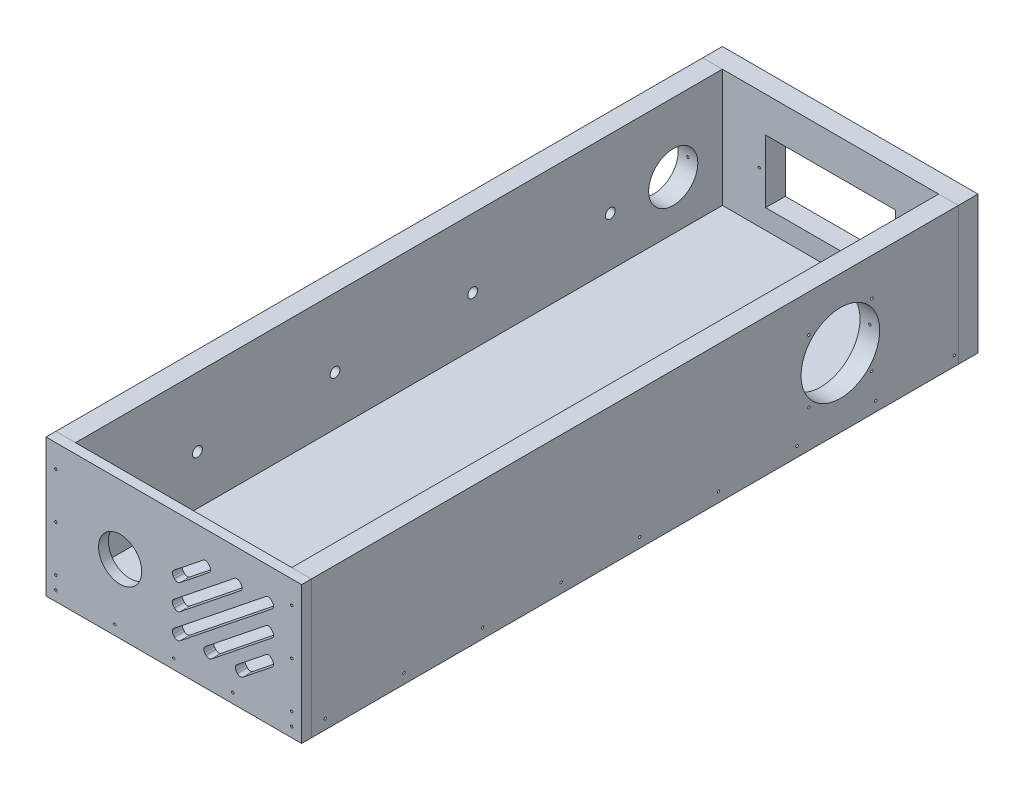
from build123d import *

# Parameters (mm, degrees)
SKETCH1_W                                = 130
SKETCH1_H                                = 344
BOSS_EXTRUDE1_DEPTH                      = 10
SKETCH2_W                                = 130
SKETCH2_H                                = 344
SKETCH2_W_2                              = 110
SKETCH2_H_2                              = 329
BOSS_EXTRUDE2_DEPTH                      = 60
CUT_EXTRUDE_THIN1_REACH                  = 359.017
CUT_EXTRUDE1_REACH                       = 359.017
SKETCH4_R                                = 11
FILLET1_R                                = 2
SKETCH5_R                                = 20
SKETCH5_W                                = 66
SKETCH5_H                                = 32
CUT_EXTRUDE4_DEPTH                       = 10
SKETCH7_R                                = 20
CUT_EXTRUDE5_DEPTH                       = 15
F_1_2_1_2_DIAMETER_HOLE1_D               = 1.2
F_1_2_1_2_DIAMETER_HOLE1_DEPTH           = 10
F_1_2_1_2_DIAMETER_HOLE1_ON_FACE_2_D     = 1.2
F_1_2_1_2_DIAMETER_HOLE1_ON_FACE_2_DEPTH = 10
F_1_2_1_2_DIAMETER_HOLE1_ON_FACE_3_D     = 1.2
F_1_2_1_2_DIAMETER_HOLE1_ON_FACE_3_DEPTH = 10
SKETCH9_R                                = 2.5
CUT_EXTRUDE6_DEPTH                       = 194.414063604
LPATTERN1_COUNT                          = 3
LPATTERN1_PITCH                          = 50
LPATTERN1_COL_COUNT                      = 3
LPATTERN1_COL_PITCH                      = 50
F_1_2_1_2_DIAMETER_HOLE2_D               = 1.2
F_1_2_1_2_DIAMETER_HOLE3_D               = 1.2
LPATTERN2_COUNT                          = 5
LPATTERN2_PITCH                          = 40
LPATTERN2_COL_COUNT                      = 5
LPATTERN2_COL_PITCH                      = 40
F_5_0_5_DIAMETER_HOLE1_D                 = 5
F_5_0_5_DIAMETER_HOLE1_DEPTH             = 10
F_25_0_25_DIAMETER_HOLE1_D               = 25
F_25_0_25_DIAMETER_HOLE1_DEPTH           = 10
SPLIT1_START                             = -172
SPLIT1_OUTLINE_W                         = 130
SPLIT1_OUTLINE_H                         = 70
SPLIT1_OUTLINE_R                         = 0.6
SPLIT1_OUTLINE_W_2                       = 66
SPLIT1_OUTLINE_H_2                       = 32
SPLIT1_DEPTH                             = 10
SPLIT1_START_2                           = 167
SPLIT1_2_OUTLINE_W                       = 130
SPLIT1_2_OUTLINE_H                       = 70
SPLIT1_2_OUTLINE_R                       = 0.6
SPLIT1_2_OUTLINE_R_2                     = 11
SPLIT1_2_DEPTH                           = 5
SPLIT1_3_OUTLINE_W                       = 130
SPLIT1_3_OUTLINE_H                       = 70
SPLIT1_3_OUTLINE_W_2                     = 66
SPLIT1_3_OUTLINE_H_2                     = 32
SPLIT1_3_OUTLINE_R                       = 0.6
SPLIT1_3_DEPTH                           = 10
SPLIT1_4_OUTLINE_W                       = 130
SPLIT1_4_OUTLINE_H                       = 70
SPLIT1_4_OUTLINE_R                       = 0.6
SPLIT1_4_OUTLINE_R_2                     = 11
SPLIT1_4_DEPTH                           = 5
SPLIT2_START                             = -65
SPLIT2_OUTLINE_W                         = 70
SPLIT2_OUTLINE_H                         = 329
SPLIT2_OUTLINE_R                         = 0.6
SPLIT2_OUTLINE_R_2                       = 12.5
SPLIT2_OUTLINE_R_3                       = 2.5
SPLIT2_DEPTH                             = 4.3999999
SPLIT2_START_2                           = -59.3999999
SPLIT2_2_OUTLINE_W                       = 70
SPLIT2_2_OUTLINE_H                       = 329
SPLIT2_2_OUTLINE_R                       = 0.6
SPLIT2_2_OUTLINE_R_2                     = 12.5
SPLIT2_2_OUTLINE_R_3                     = 2.5
SPLIT2_2_DEPTH                           = 4.3999999
SPLIT2_START_3                           = -60.6000001
SPLIT2_3_OUTLINE_W                       = 70
SPLIT2_3_OUTLINE_H                       = 329
SPLIT2_3_OUTLINE_R                       = 0.6
SPLIT2_3_OUTLINE_R_2                     = 12.5
SPLIT2_3_OUTLINE_R_3                     = 2.5
SPLIT2_3_DEPTH                           = 1.2000002
SPLIT2_START_4                           = -162
SPLIT2_4_OUTLINE_R                       = 0.6
SPLIT2_4_DEPTH                           = 329
SPLIT2_5_OUTLINE_W                       = 70
SPLIT2_5_OUTLINE_H                       = 329
SPLIT2_5_OUTLINE_R                       = 0.6
SPLIT2_5_OUTLINE_R_2                     = 12.5
SPLIT2_5_OUTLINE_R_3                     = 2.5
SPLIT2_5_DEPTH                           = 10
SPLIT2_START_5                           = 55
SPLIT2_6_OUTLINE_W                       = 70
SPLIT2_6_OUTLINE_H                       = 329
SPLIT2_6_OUTLINE_R                       = 0.6
SPLIT2_6_OUTLINE_R_2                     = 20
SPLIT2_6_DEPTH                           = 10
SPLIT2_7_OUTLINE_W                       = 70
SPLIT2_7_OUTLINE_H                       = 329
SPLIT2_7_OUTLINE_R                       = 0.6
SPLIT2_7_OUTLINE_R_2                     = 20
SPLIT2_7_DEPTH                           = 4.399999899
SPLIT2_START_6                           = 60.6000001
SPLIT2_8_OUTLINE_W                       = 70
SPLIT2_8_OUTLINE_H                       = 329
SPLIT2_8_OUTLINE_R                       = 0.6
SPLIT2_8_OUTLINE_R_2                     = 20
SPLIT2_8_DEPTH                           = 4.3999999
SPLIT2_START_7                           = 59.399999899
SPLIT2_9_OUTLINE_W                       = 70
SPLIT2_9_OUTLINE_H                       = 329
SPLIT2_9_OUTLINE_R                       = 0.6
SPLIT2_9_OUTLINE_R_2                     = 20
SPLIT2_9_DEPTH                           = 1.200000201
SPLIT2_10_OUTLINE_R                      = 0.6
SPLIT2_10_DEPTH                          = 329


with BuildPart() as part:
    # Sketch1 → Boss-Extrude1 (new body)
    with BuildSketch(Plane(origin=(0, 0, 0), x_dir=(1, 0, 0), z_dir=(0, 1, 0))):
        Rectangle(SKETCH1_W, SKETCH1_H)
    extrude(amount=BOSS_EXTRUDE1_DEPTH)

    # Sketch2 → Boss-Extrude2 (add)
    with BuildSketch(Plane(origin=(0, 10, 0), x_dir=(1, 0, 0), z_dir=(0, 1, 0))):
        Rectangle(SKETCH2_W, SKETCH2_H)
        with Locations((0, -2.5)):
            Rectangle(SKETCH2_W_2, SKETCH2_H_2, mode=Mode.SUBTRACT)
    extrude(amount=BOSS_EXTRUDE2_DEPTH)

    # Sketch3 → Cut-Extrude-Thin1 (cut, up to next)
    with BuildSketch(Plane.XY.offset(172), mode=Mode.PRIVATE) as cut_extrude_thin1_sk1:
        Polygon((48.438262381, 56.952172024), (-1.561737619, 16.952172024), (1.561737619, 13.047827976), (51.561737619, 53.047827976), align=None)
    cut_extrude_thin1_tool1 = extrude(cut_extrude_thin1_sk1.sketch, amount=-CUT_EXTRUDE_THIN1_REACH, mode=Mode.PRIVATE) & part.part
    # Sketch3 → Cut-Extrude-Thin1 (cut, up to next)
    with BuildSketch(Plane.XY.offset(172), mode=Mode.PRIVATE) as cut_extrude_thin1_sk2:
        Polygon((32.430451788, 56.952172024), (-1.561737619, 29.758420498), (1.561737619, 25.854076451), (35.553927025, 53.047827976), align=None)
    cut_extrude_thin1_tool2 = extrude(cut_extrude_thin1_sk2.sketch, amount=-CUT_EXTRUDE_THIN1_REACH, mode=Mode.PRIVATE) & part.part
    # Sketch3 → Cut-Extrude-Thin1 (cut, up to next)
    with BuildSketch(Plane.XY.offset(172), mode=Mode.PRIVATE) as cut_extrude_thin1_sk3:
        Polygon((16.422641194, 56.952172024), (-1.561737619, 42.564668973), (1.561737619, 38.660324926), (19.546116432, 53.047827976), align=None)
    cut_extrude_thin1_tool3 = extrude(cut_extrude_thin1_sk3.sketch, amount=-CUT_EXTRUDE_THIN1_REACH, mode=Mode.PRIVATE) & part.part
    # Sketch3 → Cut-Extrude-Thin1 (cut, up to next)
    with BuildSketch(Plane.XY.offset(172), mode=Mode.PRIVATE) as cut_extrude_thin1_sk4:
        Polygon((17.569548212, 13.047827976), (51.561737619, 40.241579502), (48.438262381, 44.145923549), (14.446072975, 16.952172024), align=None)
    cut_extrude_thin1_tool4 = extrude(cut_extrude_thin1_sk4.sketch, amount=-CUT_EXTRUDE_THIN1_REACH, mode=Mode.PRIVATE) & part.part
    # Sketch3 → Cut-Extrude-Thin1 (cut, up to next)
    with BuildSketch(Plane.XY.offset(172), mode=Mode.PRIVATE) as cut_extrude_thin1_sk5:
        Polygon((48.438262381, 31.339675074), (30.453883568, 16.952172024), (33.577358806, 13.047827976), (51.561737619, 27.435331027), align=None)
    cut_extrude_thin1_tool5 = extrude(cut_extrude_thin1_sk5.sketch, amount=-CUT_EXTRUDE_THIN1_REACH, mode=Mode.PRIVATE) & part.part
    add(cut_extrude_thin1_tool1.solids().sort_by_distance((25, 35, 172))[0], mode=Mode.SUBTRACT)
    add(cut_extrude_thin1_tool2.solids().sort_by_distance((16.996095, 41.403124, 172))[0], mode=Mode.SUBTRACT)
    add(cut_extrude_thin1_tool3.solids().sort_by_distance((8.992189, 47.806248, 172))[0], mode=Mode.SUBTRACT)
    add(cut_extrude_thin1_tool4.solids().sort_by_distance((33.003905, 28.596876, 172))[0], mode=Mode.SUBTRACT)
    add(cut_extrude_thin1_tool5.solids().sort_by_distance((41.007811, 22.193752, 172))[0], mode=Mode.SUBTRACT)

    # Sketch4 → Cut-Extrude1 (cut, up to next)
    with BuildSketch(Plane.XY.offset(172), mode=Mode.PRIVATE) as cut_extrude1_sk1:
        with Locations((-27.295846928, 35)):
            Circle(SKETCH4_R)
    cut_extrude1_tool1 = extrude(cut_extrude1_sk1.sketch, amount=-CUT_EXTRUDE1_REACH, mode=Mode.PRIVATE) & part.part
    add(cut_extrude1_tool1.solids().sort_by_distance((-27.295847, 35, 172))[0], mode=Mode.SUBTRACT)

    # Fillet1
    fillet1_edges = [part.edges().sort_by_distance(p)[0] for p in [
        (1.561737619, 38.660324926, 169.5),
        (19.546116432, 53.047827976, 169.5),
        (16.422641194, 56.952172024, 169.5),
        (-1.561737619, 42.564668973, 169.5),
        (1.561737619, 25.854076451, 169.5),
        (35.553927025, 53.047827976, 169.5),
        (32.430451788, 56.952172024, 169.5),
        (-1.561737619, 29.758420498, 169.5),
        (33.577358806, 13.047827976, 169.5),
        (51.561737619, 27.435331027, 169.5),
        (48.438262381, 31.339675074, 169.5),
        (30.453883568, 16.952172024, 169.5),
        (48.438262381, 44.145923549, 169.5),
        (14.446072975, 16.952172024, 169.5),
        (17.569548212, 13.047827976, 169.5),
        (51.561737619, 40.241579502, 169.5),
        (1.561737619, 13.047827976, 169.5),
        (51.561737619, 53.047827976, 169.5),
        (48.438262381, 56.952172024, 169.5),
        (-1.561737619, 16.952172024, 169.5),
    ]]
    fillet(fillet1_edges, radius=FILLET1_R)

    # Sketch5 → Cut-Extrude4 (cut)
    with BuildSketch(Plane(origin=(0, 0, -172), x_dir=(-1, 0, 0), z_dir=(0, 0, -1))):
        with Locations((51.717654472, 93.301861045)):
            Circle(SKETCH5_R)
        with Locations((0, 36)):
            Rectangle(SKETCH5_W, SKETCH5_H)
        with BuildLine():
            Line((4.717654472, 103.04865539), (4.717654472, 107.301861045))
            Line((4.717654472, 107.301861045), (18.717654472, 107.301861045))
            Line((18.717654472, 107.301861045), (18.717654472, 103.04865539))
            ThreePointArc((18.717654472, 103.04865539), (23.717654472, 93.301861045), (18.717654472, 83.5550667))
            Line((18.717654472, 83.5550667), (18.717654472, 79.301861045))
            Line((18.717654472, 79.301861045), (4.717654472, 79.301861045))
            Line((4.717654472, 79.301861045), (4.717654472, 83.5550667))
            ThreePointArc((4.717654472, 83.5550667), (-0.282345528, 93.301861045), (4.717654472, 103.04865539))
        make_face()
    extrude(amount=-CUT_EXTRUDE4_DEPTH, mode=Mode.SUBTRACT)

    # Sketch7 → Cut-Extrude5 (cut)
    with BuildSketch(Plane(origin=(65, 0, 0), x_dir=(0, 0, -1), z_dir=(1, 0, 0))):
        with Locations((102, 35)):
            Circle(SKETCH7_R)
    extrude(amount=-CUT_EXTRUDE5_DEPTH, mode=Mode.SUBTRACT)

    # Ø1.2 (1.2) Diameter Hole1
    with Locations(Plane(origin=(36.25, 36, -172), x_dir=(-1, 0, 0), z_dir=(0, 0, -1))):
        with Locations((0, 0), (72.5, 0)):
            Hole(F_1_2_1_2_DIAMETER_HOLE1_D / 2, depth=F_1_2_1_2_DIAMETER_HOLE1_DEPTH)

    # Ø1.2 (1.2) Diameter Hole1 on face 2
    with Locations(Plane(origin=(65, 51, -86), x_dir=(0, 0, 1), z_dir=(1, 0, 0))):
        with Locations((0, 0), (-32, 0), (-32, 32), (0, 32)):
            Hole(F_1_2_1_2_DIAMETER_HOLE1_ON_FACE_2_D / 2, depth=F_1_2_1_2_DIAMETER_HOLE1_ON_FACE_2_DEPTH)

    # Ø1.2 (1.2) Diameter Hole1 on face 3
    with Locations(Plane(origin=(0, 10, 83), x_dir=(0, 0, 1), z_dir=(0, 1, 0))):
        with Locations((0, 0), (-65, 0)):
            Hole(F_1_2_1_2_DIAMETER_HOLE1_ON_FACE_3_D / 2, depth=F_1_2_1_2_DIAMETER_HOLE1_ON_FACE_3_DEPTH)

    # Sketch9 → Cut-Extrude6 (cut, through all)
    with BuildSketch(Plane(origin=(0, 10, 0), x_dir=(1, 0, 0), z_dir=(0, 1, 0))):
        with Locations(Location((0, 0, 0), (0, 0, 270))):
            Circle(SKETCH9_R)
    cut_extrude6 = extrude(amount=-CUT_EXTRUDE6_DEPTH, mode=Mode.SUBTRACT)

    # LPattern1: Cut-Extrude6 ×3
    with Locations(*[(0, 0, i * LPATTERN1_PITCH) for i in range(1, LPATTERN1_COUNT)]):
        add(cut_extrude6, mode=Mode.SUBTRACT)

    # LPattern1 col: Cut-Extrude6 ×3
    with Locations(*[(0, 0, -i * LPATTERN1_COL_PITCH) for i in range(1, LPATTERN1_COL_COUNT)]):
        add(cut_extrude6, mode=Mode.SUBTRACT)

    # Ø1.2 (1.2) Diameter Hole2 (through all)
    with Locations(Plane(origin=(-60, 58.333333333, 172), x_dir=(1, 0, 0), z_dir=(0, 0, 1))):
        with Locations((0, 0), (0, -23.333333333), (0, -46.666666666), (0, -53.333333333), (30, -53.333333333), (60, -53.333333333), (90, -53.333333333), (120, -53.333333333), (120, -46.666666666), (120, -23.333333333), (120, 0)):
            Hole(F_1_2_1_2_DIAMETER_HOLE2_D / 2)

    # Ø1.2 (1.2) Diameter Hole3 (through all)
    with Locations(Plane(origin=(65, 5, 0), x_dir=(0, 0, 1), z_dir=(1, 0, 0))):
        with Locations((0, 0)):
            f_1_2_1_2_diameter_hole3 = Hole(F_1_2_1_2_DIAMETER_HOLE3_D / 2)

    # LPattern2: Ø1.2 (1.2) Diameter Hole3 ×5
    with Locations(*[(0, 0, -i * LPATTERN2_PITCH) for i in range(1, LPATTERN2_COUNT)]):
        add(f_1_2_1_2_diameter_hole3, mode=Mode.SUBTRACT)

    # LPattern2 col: Ø1.2 (1.2) Diameter Hole3 ×5
    with Locations(*[(0, 0, i * LPATTERN2_COL_PITCH) for i in range(1, LPATTERN2_COL_COUNT)]):
        add(f_1_2_1_2_diameter_hole3, mode=Mode.SUBTRACT)

    # Ø5.0 (5) Diameter Hole1
    with Locations(Plane(origin=(-55, 35, 105), x_dir=(0, 0, 1), z_dir=(1, 0, 0))):
        with Locations((0, 0), (-70, 0), (-140, 0), (-210, 0)):
            Hole(F_5_0_5_DIAMETER_HOLE1_D / 2, depth=F_5_0_5_DIAMETER_HOLE1_DEPTH)

    # Ø25.0 (25) Diameter Hole1
    with Locations(Plane(origin=(-55, 35, -137), x_dir=(0, 0, 1), z_dir=(1, 0, 0))):
        with Locations((0, 0)):
            Hole(F_25_0_25_DIAMETER_HOLE1_D / 2, depth=F_25_0_25_DIAMETER_HOLE1_DEPTH)

    # Split1 3 outline → Split1 3 (cut)
    with BuildSketch(Plane.XY.offset(SPLIT1_START)):
        with Locations((0, 35)):
            Rectangle(SPLIT1_3_OUTLINE_W, SPLIT1_3_OUTLINE_H)
        with Locations((0, 36)):
            Rectangle(SPLIT1_3_OUTLINE_W_2, SPLIT1_3_OUTLINE_H_2, mode=Mode.SUBTRACT)
        with Locations((-60, 5)):
            Circle(SPLIT1_3_OUTLINE_R, mode=Mode.SUBTRACT)
        with Locations((-60, 11.666666667)):
            Circle(SPLIT1_3_OUTLINE_R, mode=Mode.SUBTRACT)
        with Locations((-30, 5)):
            Circle(SPLIT1_3_OUTLINE_R, mode=Mode.SUBTRACT)
        with Locations((0, 5)):
            Circle(SPLIT1_3_OUTLINE_R, mode=Mode.SUBTRACT)
        with Locations((30, 5)):
            Circle(SPLIT1_3_OUTLINE_R, mode=Mode.SUBTRACT)
        with Locations((60, 5)):
            Circle(SPLIT1_3_OUTLINE_R, mode=Mode.SUBTRACT)
        with Locations((60, 11.666666667)):
            Circle(SPLIT1_3_OUTLINE_R, mode=Mode.SUBTRACT)
        with Locations((-60, 35)):
            Circle(SPLIT1_3_OUTLINE_R, mode=Mode.SUBTRACT)
        with Locations((-60, 58.333333333)):
            Circle(SPLIT1_3_OUTLINE_R, mode=Mode.SUBTRACT)
        with Locations((60, 35)):
            Circle(SPLIT1_3_OUTLINE_R, mode=Mode.SUBTRACT)
        with Locations((60, 58.333333333)):
            Circle(SPLIT1_3_OUTLINE_R, mode=Mode.SUBTRACT)
        with Locations((36.25, 36)):
            Circle(SPLIT1_3_OUTLINE_R, mode=Mode.SUBTRACT)
        with Locations((-36.25, 36)):
            Circle(SPLIT1_3_OUTLINE_R, mode=Mode.SUBTRACT)
    extrude(amount=SPLIT1_3_DEPTH, mode=Mode.SUBTRACT)

    # Split1 4 outline → Split1 4 (cut)
    with BuildSketch(Plane.XY.offset(SPLIT1_START_2)):
        with Locations((0, 35)):
            Rectangle(SPLIT1_4_OUTLINE_W, SPLIT1_4_OUTLINE_H)
        with BuildLine():
            ThreePointArc((3.123475238, 14.297218072), (1.653222091, 13.871188221), (0.312347524, 14.609565595))
            Line((0.312347524, 14.609565595), (-0.312347524, 15.390434405))
            ThreePointArc((-0.312347524, 15.390434405), (-0.738377374, 16.860687552), (0, 18.201562119))
            Line((0, 18.201562119), (46.876524762, 55.702781928))
            ThreePointArc((46.876524762, 55.702781928), (48.346777909, 56.128811779), (49.687652476, 55.390434405))
            Line((49.687652476, 55.390434405), (50.312347524, 54.609565595))
            ThreePointArc((50.312347524, 54.609565595), (50.738377374, 53.139312448), (50, 51.798437881))
            Line((50, 51.798437881), (3.123475238, 14.297218072))
        make_face(mode=Mode.SUBTRACT)
        with BuildLine():
            ThreePointArc((46.876524762, 42.896533454), (48.346777909, 43.322563304), (49.687652476, 42.58418593))
            Line((49.687652476, 42.58418593), (50.312347524, 41.80331712))
            ThreePointArc((50.312347524, 41.80331712), (50.738377374, 40.333063973), (50, 38.992189406))
            Line((50, 38.992189406), (19.131285831, 14.297218072))
            ThreePointArc((19.131285831, 14.297218072), (17.661032684, 13.871188221), (16.320158117, 14.609565595))
            Line((16.320158117, 14.609565595), (15.69546307, 15.390434405))
            ThreePointArc((15.69546307, 15.390434405), (15.269433219, 16.860687552), (16.007810594, 18.201562119))
            Line((16.007810594, 18.201562119), (46.876524762, 42.896533454))
        make_face(mode=Mode.SUBTRACT)
        with Locations((-60, 5)):
            Circle(SPLIT1_4_OUTLINE_R, mode=Mode.SUBTRACT)
        with Locations((-60, 11.666666667)):
            Circle(SPLIT1_4_OUTLINE_R, mode=Mode.SUBTRACT)
        with Locations((-30, 5)):
            Circle(SPLIT1_4_OUTLINE_R, mode=Mode.SUBTRACT)
        with Locations((0, 5)):
            Circle(SPLIT1_4_OUTLINE_R, mode=Mode.SUBTRACT)
        with Locations((30, 5)):
            Circle(SPLIT1_4_OUTLINE_R, mode=Mode.SUBTRACT)
        with Locations((60, 5)):
            Circle(SPLIT1_4_OUTLINE_R, mode=Mode.SUBTRACT)
        with Locations((60, 11.666666667)):
            Circle(SPLIT1_4_OUTLINE_R, mode=Mode.SUBTRACT)
        with BuildLine():
            ThreePointArc((35.139096425, 14.297218072), (33.668843278, 13.871188221), (32.327968711, 14.609565595))
            Line((32.327968711, 14.609565595), (31.703273663, 15.390434405))
            ThreePointArc((31.703273663, 15.390434405), (31.277243813, 16.860687552), (32.015621187, 18.201562119))
            Line((32.015621187, 18.201562119), (46.876524762, 30.090284979))
            ThreePointArc((46.876524762, 30.090284979), (48.346777909, 30.516314829), (49.687652476, 29.777937455))
            Line((49.687652476, 29.777937455), (50.312347524, 28.997068646))
            ThreePointArc((50.312347524, 28.997068646), (50.738377374, 27.526815499), (50, 26.185940932))
            Line((50, 26.185940932), (35.139096425, 14.297218072))
        make_face(mode=Mode.SUBTRACT)
        with Locations((-60, 35)):
            Circle(SPLIT1_4_OUTLINE_R, mode=Mode.SUBTRACT)
        with Locations((-60, 58.333333333)):
            Circle(SPLIT1_4_OUTLINE_R, mode=Mode.SUBTRACT)
        with Locations((60, 35)):
            Circle(SPLIT1_4_OUTLINE_R, mode=Mode.SUBTRACT)
        with Locations((60, 58.333333333)):
            Circle(SPLIT1_4_OUTLINE_R, mode=Mode.SUBTRACT)
        with BuildLine():
            Line((33.992189406, 51.798437881), (3.123475238, 27.103466546))
            ThreePointArc((3.123475238, 27.103466546), (1.653222091, 26.677436696), (0.312347524, 27.41581407))
            Line((0.312347524, 27.41581407), (-0.312347524, 28.19668288))
            ThreePointArc((-0.312347524, 28.19668288), (-0.738377374, 29.666936027), (0, 31.007810594))
            Line((0, 31.007810594), (30.868714169, 55.702781928))
            ThreePointArc((30.868714169, 55.702781928), (32.338967316, 56.128811779), (33.679841883, 55.390434405))
            Line((33.679841883, 55.390434405), (34.30453693, 54.609565595))
            ThreePointArc((34.30453693, 54.609565595), (34.730566781, 53.139312448), (33.992189406, 51.798437881))
        make_face(mode=Mode.SUBTRACT)
        with BuildLine():
            ThreePointArc((18.296726337, 54.609565595), (18.722756187, 53.139312448), (17.984378813, 51.798437881))
            Line((17.984378813, 51.798437881), (3.123475238, 39.909715021))
            ThreePointArc((3.123475238, 39.909715021), (1.653222091, 39.483685171), (0.312347524, 40.222062545))
            Line((0.312347524, 40.222062545), (-0.312347524, 41.002931354))
            ThreePointArc((-0.312347524, 41.002931354), (-0.738377374, 42.473184501), (0, 43.814059068))
            Line((0, 43.814059068), (14.860903575, 55.702781928))
            ThreePointArc((14.860903575, 55.702781928), (16.331156722, 56.128811779), (17.672031289, 55.390434405))
            Line((17.672031289, 55.390434405), (18.296726337, 54.609565595))
        make_face(mode=Mode.SUBTRACT)
        with Locations((-27.295846928, 35)):
            Circle(SPLIT1_4_OUTLINE_R_2, mode=Mode.SUBTRACT)
    extrude(amount=SPLIT1_4_DEPTH, mode=Mode.SUBTRACT)

    # Split2 5 outline → Split2 5 (cut)
    with BuildSketch(Plane.YZ.offset(SPLIT2_START)):
        with Locations((35, 2.5)):
            Rectangle(SPLIT2_5_OUTLINE_W, SPLIT2_5_OUTLINE_H)
        with Locations((5, -160)):
            Circle(SPLIT2_5_OUTLINE_R, mode=Mode.SUBTRACT)
        with Locations((5, -120)):
            Circle(SPLIT2_5_OUTLINE_R, mode=Mode.SUBTRACT)
        with Locations((5, -80)):
            Circle(SPLIT2_5_OUTLINE_R, mode=Mode.SUBTRACT)
        with Locations((5, -40)):
            Circle(SPLIT2_5_OUTLINE_R, mode=Mode.SUBTRACT)
        with Locations((5, 0)):
            Circle(SPLIT2_5_OUTLINE_R, mode=Mode.SUBTRACT)
        with Locations((35, -137)):
            Circle(SPLIT2_5_OUTLINE_R_2, mode=Mode.SUBTRACT)
        with Locations((35, -35)):
            Circle(SPLIT2_5_OUTLINE_R_3, mode=Mode.SUBTRACT)
        with Locations((5, 40)):
            Circle(SPLIT2_5_OUTLINE_R, mode=Mode.SUBTRACT)
        with Locations((5, 80)):
            Circle(SPLIT2_5_OUTLINE_R, mode=Mode.SUBTRACT)
        with Locations((5, 120)):
            Circle(SPLIT2_5_OUTLINE_R, mode=Mode.SUBTRACT)
        with Locations((5, 160)):
            Circle(SPLIT2_5_OUTLINE_R, mode=Mode.SUBTRACT)
        with Locations((35, 35)):
            Circle(SPLIT2_5_OUTLINE_R_3, mode=Mode.SUBTRACT)
        with Locations((35, 105)):
            Circle(SPLIT2_5_OUTLINE_R_3, mode=Mode.SUBTRACT)
        with Locations((35, -105)):
            Circle(SPLIT2_5_OUTLINE_R_3, mode=Mode.SUBTRACT)
    extrude(amount=SPLIT2_5_DEPTH, mode=Mode.SUBTRACT)

    # Split2 6 outline → Split2 6 (cut)
    with BuildSketch(Plane.YZ.offset(SPLIT2_START_5)):
        with Locations((35, 2.5)):
            Rectangle(SPLIT2_6_OUTLINE_W, SPLIT2_6_OUTLINE_H)
        with Locations((5, -160)):
            Circle(SPLIT2_6_OUTLINE_R, mode=Mode.SUBTRACT)
        with Locations((5, -120)):
            Circle(SPLIT2_6_OUTLINE_R, mode=Mode.SUBTRACT)
        with Locations((5, -80)):
            Circle(SPLIT2_6_OUTLINE_R, mode=Mode.SUBTRACT)
        with Locations((19, -118)):
            Circle(SPLIT2_6_OUTLINE_R, mode=Mode.SUBTRACT)
        with Locations((19, -86)):
            Circle(SPLIT2_6_OUTLINE_R, mode=Mode.SUBTRACT)
        with Locations((5, -40)):
            Circle(SPLIT2_6_OUTLINE_R, mode=Mode.SUBTRACT)
        with Locations((5, 0)):
            Circle(SPLIT2_6_OUTLINE_R, mode=Mode.SUBTRACT)
        with Locations((35, -102)):
            Circle(SPLIT2_6_OUTLINE_R_2, mode=Mode.SUBTRACT)
        with Locations((51, -118)):
            Circle(SPLIT2_6_OUTLINE_R, mode=Mode.SUBTRACT)
        with Locations((51, -86)):
            Circle(SPLIT2_6_OUTLINE_R, mode=Mode.SUBTRACT)
        with Locations((5, 40)):
            Circle(SPLIT2_6_OUTLINE_R, mode=Mode.SUBTRACT)
        with Locations((5, 80)):
            Circle(SPLIT2_6_OUTLINE_R, mode=Mode.SUBTRACT)
        with Locations((5, 120)):
            Circle(SPLIT2_6_OUTLINE_R, mode=Mode.SUBTRACT)
        with Locations((5, 160)):
            Circle(SPLIT2_6_OUTLINE_R, mode=Mode.SUBTRACT)
    extrude(amount=SPLIT2_6_DEPTH, mode=Mode.SUBTRACT)


with BuildPart() as body_2:
    # Split1: read off the stored shape, not the designer's step
    # Split1 outline → Split1 (new body)
    with BuildSketch(Plane.XY.offset(SPLIT1_START)):
        with Locations((0, 35)):
            Rectangle(SPLIT1_OUTLINE_W, SPLIT1_OUTLINE_H)
        with Locations((-60, 5)):
            Circle(SPLIT1_OUTLINE_R, mode=Mode.SUBTRACT)
        with Locations((-60, 11.666666667)):
            Circle(SPLIT1_OUTLINE_R, mode=Mode.SUBTRACT)
        with Locations((-30, 5)):
            Circle(SPLIT1_OUTLINE_R, mode=Mode.SUBTRACT)
        with Locations((0, 5)):
            Circle(SPLIT1_OUTLINE_R, mode=Mode.SUBTRACT)
        with Locations((30, 5)):
            Circle(SPLIT1_OUTLINE_R, mode=Mode.SUBTRACT)
        with Locations((60, 5)):
            Circle(SPLIT1_OUTLINE_R, mode=Mode.SUBTRACT)
        with Locations((60, 11.666666667)):
            Circle(SPLIT1_OUTLINE_R, mode=Mode.SUBTRACT)
        with Locations((-60, 35)):
            Circle(SPLIT1_OUTLINE_R, mode=Mode.SUBTRACT)
        with Locations((-36.25, 36)):
            Circle(SPLIT1_OUTLINE_R, mode=Mode.SUBTRACT)
        with Locations((-60, 58.333333333)):
            Circle(SPLIT1_OUTLINE_R, mode=Mode.SUBTRACT)
        with Locations((0, 36)):
            Rectangle(SPLIT1_OUTLINE_W_2, SPLIT1_OUTLINE_H_2, mode=Mode.SUBTRACT)
        with Locations((36.25, 36)):
            Circle(SPLIT1_OUTLINE_R, mode=Mode.SUBTRACT)
        with Locations((60, 35)):
            Circle(SPLIT1_OUTLINE_R, mode=Mode.SUBTRACT)
        with Locations((60, 58.333333333)):
            Circle(SPLIT1_OUTLINE_R, mode=Mode.SUBTRACT)
    extrude(amount=SPLIT1_DEPTH)


with BuildPart() as body_3:
    # Split1 2 outline → Split1 2 (new body)
    with BuildSketch(Plane.XY.offset(SPLIT1_START_2)):
        with Locations((0, 35)):
            Rectangle(SPLIT1_2_OUTLINE_W, SPLIT1_2_OUTLINE_H)
        with Locations((-60, 5)):
            Circle(SPLIT1_2_OUTLINE_R, mode=Mode.SUBTRACT)
        with Locations((-60, 11.666666667)):
            Circle(SPLIT1_2_OUTLINE_R, mode=Mode.SUBTRACT)
        with Locations((-30, 5)):
            Circle(SPLIT1_2_OUTLINE_R, mode=Mode.SUBTRACT)
        with Locations((0, 5)):
            Circle(SPLIT1_2_OUTLINE_R, mode=Mode.SUBTRACT)
        with Locations((30, 5)):
            Circle(SPLIT1_2_OUTLINE_R, mode=Mode.SUBTRACT)
        with Locations((60, 5)):
            Circle(SPLIT1_2_OUTLINE_R, mode=Mode.SUBTRACT)
        with Locations((60, 11.666666667)):
            Circle(SPLIT1_2_OUTLINE_R, mode=Mode.SUBTRACT)
        with BuildLine():
            ThreePointArc((46.876524762, 30.090284979), (48.346777909, 30.516314829), (49.687652476, 29.777937455))
            Line((49.687652476, 29.777937455), (50.312347524, 28.997068646))
            ThreePointArc((50.312347524, 28.997068646), (50.738377374, 27.526815499), (50, 26.185940932))
            Line((50, 26.185940932), (35.139096425, 14.297218072))
            ThreePointArc((35.139096425, 14.297218072), (33.668843278, 13.871188221), (32.327968711, 14.609565595))
            Line((32.327968711, 14.609565595), (31.703273663, 15.390434405))
            ThreePointArc((31.703273663, 15.390434405), (31.277243813, 16.860687552), (32.015621187, 18.201562119))
            Line((32.015621187, 18.201562119), (46.876524762, 30.090284979))
        make_face(mode=Mode.SUBTRACT)
        with BuildLine():
            ThreePointArc((19.131285831, 14.297218072), (17.661032684, 13.871188221), (16.320158117, 14.609565595))
            Line((16.320158117, 14.609565595), (15.69546307, 15.390434405))
            ThreePointArc((15.69546307, 15.390434405), (15.269433219, 16.860687552), (16.007810594, 18.201562119))
            Line((16.007810594, 18.201562119), (46.876524762, 42.896533454))
            ThreePointArc((46.876524762, 42.896533454), (48.346777909, 43.322563304), (49.687652476, 42.58418593))
            Line((49.687652476, 42.58418593), (50.312347524, 41.80331712))
            ThreePointArc((50.312347524, 41.80331712), (50.738377374, 40.333063973), (50, 38.992189406))
            Line((50, 38.992189406), (19.131285831, 14.297218072))
        make_face(mode=Mode.SUBTRACT)
        with Locations((-60, 35)):
            Circle(SPLIT1_2_OUTLINE_R, mode=Mode.SUBTRACT)
        with Locations((-27.295846928, 35)):
            Circle(SPLIT1_2_OUTLINE_R_2, mode=Mode.SUBTRACT)
        with Locations((-60, 58.333333333)):
            Circle(SPLIT1_2_OUTLINE_R, mode=Mode.SUBTRACT)
        with BuildLine():
            ThreePointArc((46.876524762, 55.702781928), (48.346777909, 56.128811779), (49.687652476, 55.390434405))
            Line((49.687652476, 55.390434405), (50.312347524, 54.609565595))
            ThreePointArc((50.312347524, 54.609565595), (50.738377374, 53.139312448), (50, 51.798437881))
            Line((50, 51.798437881), (3.123475238, 14.297218072))
            ThreePointArc((3.123475238, 14.297218072), (1.653222091, 13.871188221), (0.312347524, 14.609565595))
            Line((0.312347524, 14.609565595), (-0.312347524, 15.390434405))
            ThreePointArc((-0.312347524, 15.390434405), (-0.738377374, 16.860687552), (0, 18.201562119))
            Line((0, 18.201562119), (46.876524762, 55.702781928))
        make_face(mode=Mode.SUBTRACT)
        with BuildLine():
            ThreePointArc((3.123475238, 27.103466546), (1.653222091, 26.677436696), (0.312347524, 27.41581407))
            Line((0.312347524, 27.41581407), (-0.312347524, 28.19668288))
            ThreePointArc((-0.312347524, 28.19668288), (-0.738377374, 29.666936027), (0, 31.007810594))
            Line((0, 31.007810594), (30.868714169, 55.702781928))
            ThreePointArc((30.868714169, 55.702781928), (32.338967316, 56.128811779), (33.679841883, 55.390434405))
            Line((33.679841883, 55.390434405), (34.30453693, 54.609565595))
            ThreePointArc((34.30453693, 54.609565595), (34.730566781, 53.139312448), (33.992189406, 51.798437881))
            Line((33.992189406, 51.798437881), (3.123475238, 27.103466546))
        make_face(mode=Mode.SUBTRACT)
        with BuildLine():
            ThreePointArc((14.860903575, 55.702781928), (16.331156722, 56.128811779), (17.672031289, 55.390434405))
            Line((17.672031289, 55.390434405), (18.296726337, 54.609565595))
            ThreePointArc((18.296726337, 54.609565595), (18.722756187, 53.139312448), (17.984378813, 51.798437881))
            Line((17.984378813, 51.798437881), (3.123475238, 39.909715021))
            ThreePointArc((3.123475238, 39.909715021), (1.653222091, 39.483685171), (0.312347524, 40.222062545))
            Line((0.312347524, 40.222062545), (-0.312347524, 41.002931354))
            ThreePointArc((-0.312347524, 41.002931354), (-0.738377374, 42.473184501), (0, 43.814059068))
            Line((0, 43.814059068), (14.860903575, 55.702781928))
        make_face(mode=Mode.SUBTRACT)
        with Locations((60, 35)):
            Circle(SPLIT1_2_OUTLINE_R, mode=Mode.SUBTRACT)
        with Locations((60, 58.333333333)):
            Circle(SPLIT1_2_OUTLINE_R, mode=Mode.SUBTRACT)
    extrude(amount=SPLIT1_2_DEPTH)


with BuildPart() as body_4:
    # Split2: read off the stored shape, not the designer's step
    # Split2 outline → Split2 (new body)
    with BuildSketch(Plane.YZ.offset(SPLIT2_START)):
        with Locations((35, 2.5)):
            Rectangle(SPLIT2_OUTLINE_W, SPLIT2_OUTLINE_H)
        with Locations((5, -160)):
            Circle(SPLIT2_OUTLINE_R, mode=Mode.SUBTRACT)
        with Locations((5, -120)):
            Circle(SPLIT2_OUTLINE_R, mode=Mode.SUBTRACT)
        with Locations((5, -80)):
            Circle(SPLIT2_OUTLINE_R, mode=Mode.SUBTRACT)
        with Locations((5, -40)):
            Circle(SPLIT2_OUTLINE_R, mode=Mode.SUBTRACT)
        with Locations((5, 0)):
            Circle(SPLIT2_OUTLINE_R, mode=Mode.SUBTRACT)
        with Locations((35, -137)):
            Circle(SPLIT2_OUTLINE_R_2, mode=Mode.SUBTRACT)
        with Locations((35, -105)):
            Circle(SPLIT2_OUTLINE_R_3, mode=Mode.SUBTRACT)
        with Locations((35, -35)):
            Circle(SPLIT2_OUTLINE_R_3, mode=Mode.SUBTRACT)
        with Locations((5, 40)):
            Circle(SPLIT2_OUTLINE_R, mode=Mode.SUBTRACT)
        with Locations((5, 80)):
            Circle(SPLIT2_OUTLINE_R, mode=Mode.SUBTRACT)
        with Locations((5, 120)):
            Circle(SPLIT2_OUTLINE_R, mode=Mode.SUBTRACT)
        with Locations((5, 160)):
            Circle(SPLIT2_OUTLINE_R, mode=Mode.SUBTRACT)
        with Locations((35, 35)):
            Circle(SPLIT2_OUTLINE_R_3, mode=Mode.SUBTRACT)
        with Locations((35, 105)):
            Circle(SPLIT2_OUTLINE_R_3, mode=Mode.SUBTRACT)
    extrude(amount=SPLIT2_DEPTH)

    # Split2 2 outline → Split2 2 (add)
    with BuildSketch(Plane.YZ.offset(SPLIT2_START_2)):
        with Locations((35, 2.5)):
            Rectangle(SPLIT2_2_OUTLINE_W, SPLIT2_2_OUTLINE_H)
        with Locations((5, -160)):
            Circle(SPLIT2_2_OUTLINE_R, mode=Mode.SUBTRACT)
        with Locations((5, -120)):
            Circle(SPLIT2_2_OUTLINE_R, mode=Mode.SUBTRACT)
        with Locations((5, -80)):
            Circle(SPLIT2_2_OUTLINE_R, mode=Mode.SUBTRACT)
        with Locations((5, -40)):
            Circle(SPLIT2_2_OUTLINE_R, mode=Mode.SUBTRACT)
        with Locations((5, 0)):
            Circle(SPLIT2_2_OUTLINE_R, mode=Mode.SUBTRACT)
        with Locations((35, -137)):
            Circle(SPLIT2_2_OUTLINE_R_2, mode=Mode.SUBTRACT)
        with Locations((35, -105)):
            Circle(SPLIT2_2_OUTLINE_R_3, mode=Mode.SUBTRACT)
        with Locations((35, -35)):
            Circle(SPLIT2_2_OUTLINE_R_3, mode=Mode.SUBTRACT)
        with Locations((5, 40)):
            Circle(SPLIT2_2_OUTLINE_R, mode=Mode.SUBTRACT)
        with Locations((5, 80)):
            Circle(SPLIT2_2_OUTLINE_R, mode=Mode.SUBTRACT)
        with Locations((5, 120)):
            Circle(SPLIT2_2_OUTLINE_R, mode=Mode.SUBTRACT)
        with Locations((5, 160)):
            Circle(SPLIT2_2_OUTLINE_R, mode=Mode.SUBTRACT)
        with Locations((35, 35)):
            Circle(SPLIT2_2_OUTLINE_R_3, mode=Mode.SUBTRACT)
        with Locations((35, 105)):
            Circle(SPLIT2_2_OUTLINE_R_3, mode=Mode.SUBTRACT)
    extrude(amount=SPLIT2_2_DEPTH)

    # Split2 3 outline → Split2 3 (add)
    with BuildSketch(Plane.YZ.offset(SPLIT2_START_3)):
        with Locations((35, 2.5)):
            Rectangle(SPLIT2_3_OUTLINE_W, SPLIT2_3_OUTLINE_H)
        with Locations((5, -160)):
            Circle(SPLIT2_3_OUTLINE_R, mode=Mode.SUBTRACT)
        with Locations((5, -120)):
            Circle(SPLIT2_3_OUTLINE_R, mode=Mode.SUBTRACT)
        with Locations((5, -80)):
            Circle(SPLIT2_3_OUTLINE_R, mode=Mode.SUBTRACT)
        with Locations((5, -40)):
            Circle(SPLIT2_3_OUTLINE_R, mode=Mode.SUBTRACT)
        with Locations((5, 0)):
            Circle(SPLIT2_3_OUTLINE_R, mode=Mode.SUBTRACT)
        with Locations((35, -137)):
            Circle(SPLIT2_3_OUTLINE_R_2, mode=Mode.SUBTRACT)
        with Locations((35, -105)):
            Circle(SPLIT2_3_OUTLINE_R_3, mode=Mode.SUBTRACT)
        with Locations((35, -35)):
            Circle(SPLIT2_3_OUTLINE_R_3, mode=Mode.SUBTRACT)
        with Locations((5, 40)):
            Circle(SPLIT2_3_OUTLINE_R, mode=Mode.SUBTRACT)
        with Locations((5, 80)):
            Circle(SPLIT2_3_OUTLINE_R, mode=Mode.SUBTRACT)
        with Locations((5, 120)):
            Circle(SPLIT2_3_OUTLINE_R, mode=Mode.SUBTRACT)
        with Locations((5, 160)):
            Circle(SPLIT2_3_OUTLINE_R, mode=Mode.SUBTRACT)
        with Locations((35, 35)):
            Circle(SPLIT2_3_OUTLINE_R_3, mode=Mode.SUBTRACT)
        with Locations((35, 105)):
            Circle(SPLIT2_3_OUTLINE_R_3, mode=Mode.SUBTRACT)
    extrude(amount=SPLIT2_3_DEPTH)

    # Split2 4 outline → Split2 4 (cut)
    with BuildSketch(Plane.XY.offset(SPLIT2_START_4)):
        with Locations((-60, 5)):
            Circle(SPLIT2_4_OUTLINE_R)
        with Locations((-60, 35)):
            Circle(SPLIT2_4_OUTLINE_R)
        with Locations((-60, 11.666666667)):
            Circle(SPLIT2_4_OUTLINE_R)
        with Locations((-60, 58.333333333)):
            Circle(SPLIT2_4_OUTLINE_R)
    extrude(amount=SPLIT2_4_DEPTH, mode=Mode.SUBTRACT)


with BuildPart() as body_5:
    # Split2 7 outline → Split2 7 (new body)
    with BuildSketch(Plane.YZ.offset(SPLIT2_START_5)):
        with Locations((35, 2.5)):
            Rectangle(SPLIT2_7_OUTLINE_W, SPLIT2_7_OUTLINE_H)
        with Locations((5, -160)):
            Circle(SPLIT2_7_OUTLINE_R, mode=Mode.SUBTRACT)
        with Locations((5, -120)):
            Circle(SPLIT2_7_OUTLINE_R, mode=Mode.SUBTRACT)
        with Locations((5, -80)):
            Circle(SPLIT2_7_OUTLINE_R, mode=Mode.SUBTRACT)
        with Locations((19, -118)):
            Circle(SPLIT2_7_OUTLINE_R, mode=Mode.SUBTRACT)
        with Locations((19, -86)):
            Circle(SPLIT2_7_OUTLINE_R, mode=Mode.SUBTRACT)
        with Locations((5, -40)):
            Circle(SPLIT2_7_OUTLINE_R, mode=Mode.SUBTRACT)
        with Locations((5, 0)):
            Circle(SPLIT2_7_OUTLINE_R, mode=Mode.SUBTRACT)
        with Locations((35, -102)):
            Circle(SPLIT2_7_OUTLINE_R_2, mode=Mode.SUBTRACT)
        with Locations((51, -118)):
            Circle(SPLIT2_7_OUTLINE_R, mode=Mode.SUBTRACT)
        with Locations((51, -86)):
            Circle(SPLIT2_7_OUTLINE_R, mode=Mode.SUBTRACT)
        with Locations((5, 40)):
            Circle(SPLIT2_7_OUTLINE_R, mode=Mode.SUBTRACT)
        with Locations((5, 80)):
            Circle(SPLIT2_7_OUTLINE_R, mode=Mode.SUBTRACT)
        with Locations((5, 120)):
            Circle(SPLIT2_7_OUTLINE_R, mode=Mode.SUBTRACT)
        with Locations((5, 160)):
            Circle(SPLIT2_7_OUTLINE_R, mode=Mode.SUBTRACT)
    extrude(amount=SPLIT2_7_DEPTH)

    # Split2 8 outline → Split2 8 (add)
    with BuildSketch(Plane.YZ.offset(SPLIT2_START_6)):
        with Locations((35, 2.5)):
            Rectangle(SPLIT2_8_OUTLINE_W, SPLIT2_8_OUTLINE_H)
        with Locations((5, -160)):
            Circle(SPLIT2_8_OUTLINE_R, mode=Mode.SUBTRACT)
        with Locations((5, -120)):
            Circle(SPLIT2_8_OUTLINE_R, mode=Mode.SUBTRACT)
        with Locations((5, -80)):
            Circle(SPLIT2_8_OUTLINE_R, mode=Mode.SUBTRACT)
        with Locations((19, -118)):
            Circle(SPLIT2_8_OUTLINE_R, mode=Mode.SUBTRACT)
        with Locations((19, -86)):
            Circle(SPLIT2_8_OUTLINE_R, mode=Mode.SUBTRACT)
        with Locations((5, -40)):
            Circle(SPLIT2_8_OUTLINE_R, mode=Mode.SUBTRACT)
        with Locations((5, 0)):
            Circle(SPLIT2_8_OUTLINE_R, mode=Mode.SUBTRACT)
        with Locations((35, -102)):
            Circle(SPLIT2_8_OUTLINE_R_2, mode=Mode.SUBTRACT)
        with Locations((51, -118)):
            Circle(SPLIT2_8_OUTLINE_R, mode=Mode.SUBTRACT)
        with Locations((51, -86)):
            Circle(SPLIT2_8_OUTLINE_R, mode=Mode.SUBTRACT)
        with Locations((5, 40)):
            Circle(SPLIT2_8_OUTLINE_R, mode=Mode.SUBTRACT)
        with Locations((5, 80)):
            Circle(SPLIT2_8_OUTLINE_R, mode=Mode.SUBTRACT)
        with Locations((5, 120)):
            Circle(SPLIT2_8_OUTLINE_R, mode=Mode.SUBTRACT)
        with Locations((5, 160)):
            Circle(SPLIT2_8_OUTLINE_R, mode=Mode.SUBTRACT)
    extrude(amount=SPLIT2_8_DEPTH)

    # Split2 9 outline → Split2 9 (add)
    with BuildSketch(Plane.YZ.offset(SPLIT2_START_7)):
        with Locations((35, 2.5)):
            Rectangle(SPLIT2_9_OUTLINE_W, SPLIT2_9_OUTLINE_H)
        with Locations((5, -160)):
            Circle(SPLIT2_9_OUTLINE_R, mode=Mode.SUBTRACT)
        with Locations((5, -120)):
            Circle(SPLIT2_9_OUTLINE_R, mode=Mode.SUBTRACT)
        with Locations((5, -80)):
            Circle(SPLIT2_9_OUTLINE_R, mode=Mode.SUBTRACT)
        with Locations((19, -118)):
            Circle(SPLIT2_9_OUTLINE_R, mode=Mode.SUBTRACT)
        with Locations((19, -86)):
            Circle(SPLIT2_9_OUTLINE_R, mode=Mode.SUBTRACT)
        with Locations((5, -40)):
            Circle(SPLIT2_9_OUTLINE_R, mode=Mode.SUBTRACT)
        with Locations((5, 0)):
            Circle(SPLIT2_9_OUTLINE_R, mode=Mode.SUBTRACT)
        with Locations((35, -102)):
            Circle(SPLIT2_9_OUTLINE_R_2, mode=Mode.SUBTRACT)
        with Locations((51, -118)):
            Circle(SPLIT2_9_OUTLINE_R, mode=Mode.SUBTRACT)
        with Locations((51, -86)):
            Circle(SPLIT2_9_OUTLINE_R, mode=Mode.SUBTRACT)
        with Locations((5, 40)):
            Circle(SPLIT2_9_OUTLINE_R, mode=Mode.SUBTRACT)
        with Locations((5, 80)):
            Circle(SPLIT2_9_OUTLINE_R, mode=Mode.SUBTRACT)
        with Locations((5, 120)):
            Circle(SPLIT2_9_OUTLINE_R, mode=Mode.SUBTRACT)
        with Locations((5, 160)):
            Circle(SPLIT2_9_OUTLINE_R, mode=Mode.SUBTRACT)
    extrude(amount=SPLIT2_9_DEPTH)

    # Split2 10 outline → Split2 10 (cut)
    with BuildSketch(Plane.XY.offset(SPLIT2_START_4)):
        with Locations((60, 5)):
            Circle(SPLIT2_10_OUTLINE_R)
        with Locations((60, 35)):
            Circle(SPLIT2_10_OUTLINE_R)
        with Locations((60, 58.333333333)):
            Circle(SPLIT2_10_OUTLINE_R)
        with Locations((60, 11.666666667)):
            Circle(SPLIT2_10_OUTLINE_R)
    extrude(amount=SPLIT2_10_DEPTH, mode=Mode.SUBTRACT)


solid = Compound([part.part, body_2.part, body_3.part, body_4.part, body_5.part])
